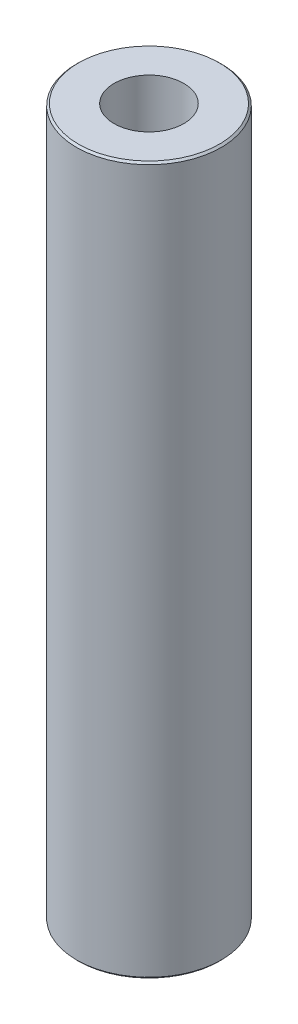
from build123d import *
from OCP.BRepFilletAPI import BRepFilletAPI_MakeChamfer

# Parameters (mm, degrees)
SKETCH1_R           = 57.5
BOSS_EXTRUDE1_DEPTH = 561.93399869
SKETCH2_R           = 27.701721046
CUT_EXTRUDE1_DEPTH  = 568.78721268
CHAMFER1_SIZE       = 1.466982658
CHAMFER1_SIZE2      = 1.547225687


with BuildPart() as part:
    # Sketch1 → Boss-Extrude1 (new body)
    with BuildSketch(Plane(origin=(0, 0, 0), x_dir=(1, 0, 0), z_dir=(0, 1, 0))):
        Circle(SKETCH1_R)
    extrude(amount=BOSS_EXTRUDE1_DEPTH)

    # Sketch2 → Cut-Extrude1 (cut, through all)
    with BuildSketch(Plane(origin=(0, 0, 0), x_dir=(1, 0, 0), z_dir=(0, 1, 0))):
        Circle(SKETCH2_R)
    extrude(amount=CUT_EXTRUDE1_DEPTH, mode=Mode.SUBTRACT)

    # Chamfer1: one chamfer whose edges measure the first distance from different faces: ONE call of the kernel's chamfer builder (chamfer() names one face for all edges)
    chamfer1_edges_1 = [part.edges().sort_by_distance(p)[0] for p in [
        (-57.5, 561.93399869, 0),
    ]]
    chamfer1_side_1 = [part.faces().sort_by_distance(p)[0] for p in [
        (-57.5, 280.966999345, 0),
    ]]
    chamfer1_edges_2 = [part.edges().sort_by_distance(p)[0] for p in [
        (-57.5, 0, 0),
    ]]
    chamfer1_side_2 = [part.faces().sort_by_distance(p)[0] for p in [
        (-55.873654403, 0, 0),
    ]]
    chamfer1 = BRepFilletAPI_MakeChamfer(part.part.solid().wrapped)
    for e in chamfer1_edges_1:
        chamfer1.Add(CHAMFER1_SIZE, CHAMFER1_SIZE2, e.wrapped, chamfer1_side_1[0].wrapped)  # the first distance lies on this face
    for e in chamfer1_edges_2:
        chamfer1.Add(CHAMFER1_SIZE, CHAMFER1_SIZE2, e.wrapped, chamfer1_side_2[0].wrapped)  # the first distance lies on this face
    add(Compound.cast(chamfer1.Shape()), mode=Mode.REPLACE)


solid = part.part
